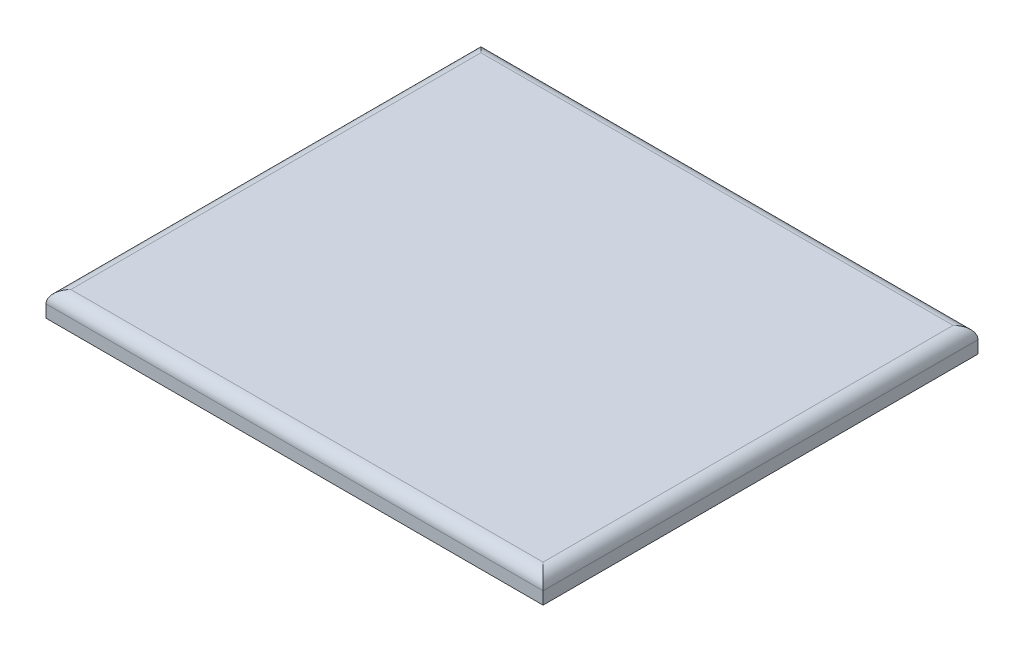
from build123d import *

# Parameters (mm, degrees)
SKETCH1_W           = 400
SKETCH1_H           = 350
BOSS_EXTRUDE1_DEPTH = 20
FILLET1_R           = 10


with BuildPart() as part:
    # Sketch1 → Boss-Extrude1 (new body)
    with BuildSketch(Plane(origin=(0, 0, 0), x_dir=(1, 0, 0), z_dir=(0, 1, 0))):
        Rectangle(SKETCH1_W, SKETCH1_H)
    extrude(amount=BOSS_EXTRUDE1_DEPTH)

    # Fillet1
    fillet1_edges = [part.edges().sort_by_distance(p)[0] for p in [
        (0, 20, 175),
        (-200, 20, 0),
        (0, 20, -175),
        (200, 20, 0),
    ]]
    fillet(fillet1_edges, radius=FILLET1_R)


solid = part.part
